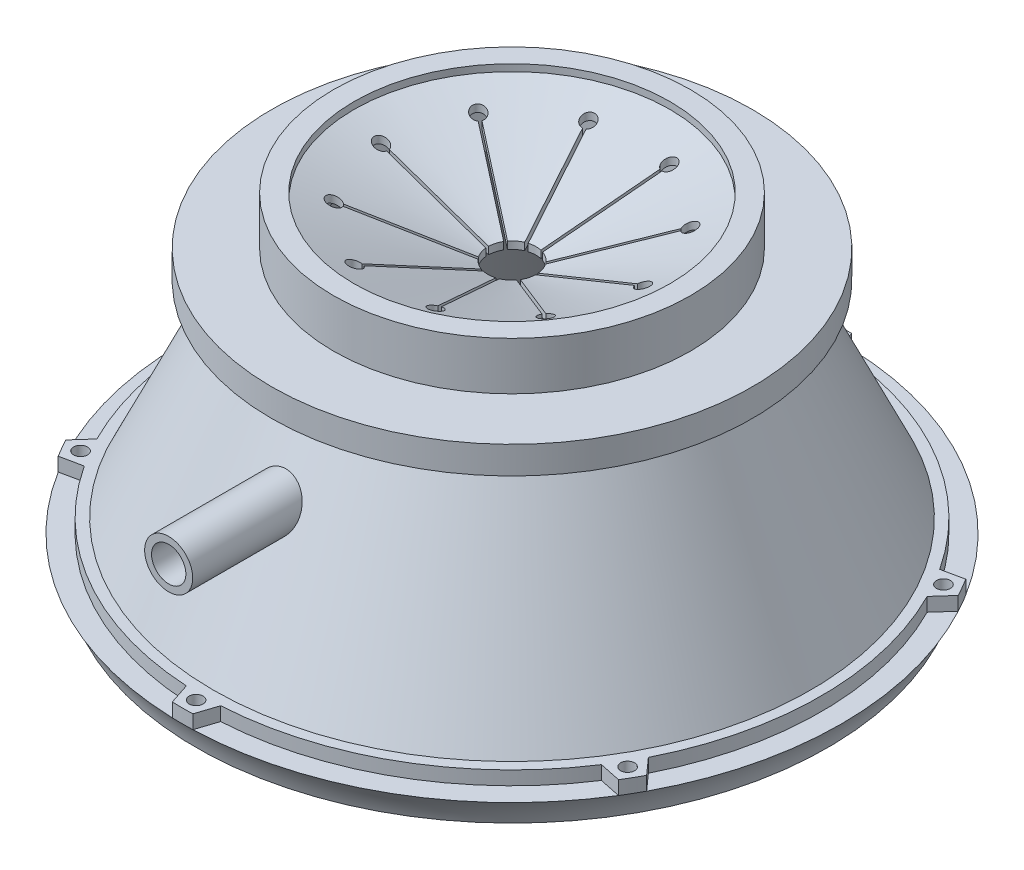
from build123d import *

# Parameters (mm, degrees)
SKETCH2_R           = 51.435
BOSS_EXTRUDE1_DEPTH = 2.54
SKETCH4_R           = 44.45
SKETCH4_R_2         = 29.21
BOSS_EXTRUDE2_DEPTH = 5.08
SKETCH7_R           = 33.02
SKETCH7_R_2         = 29.21
BOSS_EXTRUDE3_DEPTH = 8.89
CUT_EXTRUDE2_START  = -13.9700001
CUT_EXTRUDE2_DEPTH  = 10.974698256
SKETCH10_R          = 1.285113885
CUT_EXTRUDE3_DEPTH  = 2.54
CIRPATTERN1_COUNT   = 6
BOSS_EXTRUDE4_REACH = 152.895
SKETCH11_R          = 4.445
SKETCH12_R          = 3.175
CUT_EXTRUDE4_DEPTH  = 25.4


# Read off the part's stored shape, not the designer's step: Cut-Extrude2
with BuildPart() as part:
    # Sketch1 → Revolve1 (revolve)
    with BuildSketch(Plane.XY, mode=Mode.PRIVATE) as revolve1_sk:
        with BuildLine():
            Line((60.96, 5.08), (53.34, 5.08))
            Line((53.34, 5.08), (53.34, 0))
            Line((53.34, 0), (58.42, 0))
            ThreePointArc((58.42, 0), (59.483398793, 2.643300604), (60.96, 5.08))
        make_face()
    revolve(revolve1_sk.sketch.rotate(Axis((0, 0, 0), (0, 1, 0)), 90), axis=Axis((0, 0, 0), (0, 1, 0)))

    # Sketch2 → Boss-Extrude1 (add)
    with BuildSketch(Plane(origin=(0, 5.08, 0), x_dir=(1, 0, 0), z_dir=(0, 1, 0))):
        with BuildLine():
            Line((-1.905, 60.930227104), (-3.175, 57.061737399))
            ThreePointArc((-3.175, 57.061737399), (-28.575, 49.493351826), (-47.829414172, 31.280499357))
            Line((-47.829414172, 31.280499357), (-51.814624531, 32.114891946))
            ThreePointArc((-51.814624531, 32.114891946), (-52.792908615, 30.48), (-53.719624531, 28.815335158))
            Line((-53.719624531, 28.815335158), (-51.004414172, 25.781238043))
            ThreePointArc((-51.004414172, 25.781238043), (-57.15, 0), (-51.004414172, -25.781238043))
            Line((-51.004414172, -25.781238043), (-53.719624531, -28.815335158))
            ThreePointArc((-53.719624531, -28.815335158), (-52.792908615, -30.48), (-51.814624531, -32.114891946))
            Line((-51.814624531, -32.114891946), (-47.829414172, -31.280499357))
            ThreePointArc((-47.829414172, -31.280499357), (-28.575, -49.493351826), (-3.175, -57.061737399))
            Line((-3.175, -57.061737399), (-1.905, -60.930227104))
            ThreePointArc((-1.905, -60.930227104), (0, -60.96), (1.905, -60.930227104))
            Line((1.905, -60.930227104), (3.175, -57.061737399))
            ThreePointArc((3.175, -57.061737399), (28.575, -49.493351826), (47.829414172, -31.280499357))
            Line((47.829414172, -31.280499357), (51.814624531, -32.114891946))
            ThreePointArc((51.814624531, -32.114891946), (52.792908615, -30.48), (53.719624531, -28.815335158))
            Line((53.719624531, -28.815335158), (51.004414172, -25.781238043))
            ThreePointArc((51.004414172, -25.781238043), (57.15, 0), (51.004414172, 25.781238043))
            Line((51.004414172, 25.781238043), (53.719624531, 28.815335158))
            ThreePointArc((53.719624531, 28.815335158), (52.792908615, 30.48), (51.814624531, 32.114891946))
            Line((51.814624531, 32.114891946), (47.829414172, 31.280499357))
            ThreePointArc((47.829414172, 31.280499357), (28.575, 49.493351826), (3.175, 57.061737399))
            Line((3.175, 57.061737399), (1.905, 60.930227104))
            ThreePointArc((1.905, 60.930227104), (0, 60.96), (-1.905, 60.930227104))
        make_face()
        with Locations(Location((0, 0, 0), (0, 0, 270))):
            Circle(SKETCH2_R, mode=Mode.SUBTRACT)
    extrude(amount=BOSS_EXTRUDE1_DEPTH)

    # Sketch3 → Revolve2 (revolve)
    with BuildSketch(Plane.XY, mode=Mode.PRIVATE) as revolve2_sk:
        Polygon((-51.435, 7.62), (-33.668678224, 45.72), (-37.478678224, 45.72), (-55.245, 7.62), align=None)
    revolve(revolve2_sk.sketch.rotate(Axis((0, 45.72, 0), (0, 1, 0)), 90), axis=Axis((0, 45.72, 0), (0, 1, 0)))

    # Sketch4 → Boss-Extrude2 (add)
    with BuildSketch(Plane(origin=(0, 45.72, 0), x_dir=(1, 0, 0), z_dir=(0, 1, 0))):
        with Locations(Location((0, 0, 0), (0, 0, 270))):
            Circle(SKETCH4_R)
        with Locations(Location((0, 0, 0), (0, 0, 270))):
            Circle(SKETCH4_R_2, mode=Mode.SUBTRACT)
    extrude(amount=BOSS_EXTRUDE2_DEPTH)

    # Sketch7 → Boss-Extrude3 (add)
    with BuildSketch(Plane(origin=(0, 50.8, 0), x_dir=(1, 0, 0), z_dir=(0, 1, 0))):
        with Locations(Location((0, 0, 0), (0, 0, 270))):
            Circle(SKETCH7_R)
        with Locations(Location((0, 0, 0), (0, 0, 270))):
            Circle(SKETCH7_R_2, mode=Mode.SUBTRACT)
    extrude(amount=BOSS_EXTRUDE3_DEPTH)

    # Sketch8 → Revolve3 (revolve)
    with BuildSketch(Plane.XY, mode=Mode.PRIVATE) as revolve3_sk:
        Polygon((0, 47.082311557), (29.21, 58.42), (29.21, 57.057688443), (0, 45.72), align=None)
    revolve(revolve3_sk.sketch.rotate(Axis((0, 50.8, 0), (0, -1, 0)), 90), axis=Axis((0, 50.8, 0), (0, -1, 0)))

    # Cut-Extrude2 outline → Cut-Extrude2 (cut)
    with BuildSketch(Plane(origin=(0, 59.69, 0), x_dir=(1, 0, 0), z_dir=(0, 1, 0)).offset(CUT_EXTRUDE2_START)):
        with BuildLine():
            ThreePointArc((-0.994569109, -4.339743459), (0.141521891, -4.450001411), (1.2683112, -4.267777841))
            Line((1.2683112, -4.267777841), (7.306062216, -21.018511035))
            ThreePointArc((7.306062216, -21.018511035), (8.397605671, -23.297756201), (7.783964777, -20.84625248))
            Line((7.783964777, -20.84625248), (1.746213892, -4.095519264))
            ThreePointArc((1.746213892, -4.095519264), (2.730138817, -3.516942286), (3.53462219, -2.707210183))
            Line((3.53462219, -2.707210183), (18.26509934, -12.70993692))
            ThreePointArc((18.26509934, -12.70993692), (20.487883195, -13.912291948), (18.550479529, -12.289672857))
            Line((18.550479529, -12.289672857), (3.820002538, -2.286945912))
            ThreePointArc((3.820002538, -2.286945912), (4.275935508, -1.240530744), (4.450827641, -0.112580249))
            Line((4.450827641, -0.112580249), (22.247489269, 0.453400975))
            ThreePointArc((22.247489269, 0.453400975), (24.752485716, 0.787194932), (22.231341683, 0.961144263))
            Line((22.231341683, 0.961144263), (4.434680052, 0.395163048))
            ThreePointArc((4.434680052, 0.395163048), (4.18847017, 1.509721378), (3.666968211, 2.525051513))
            Line((3.666968211, 2.525051513), (17.732094251, 13.443555396))
            ThreePointArc((17.732094251, 13.443555396), (19.562480099, 15.186000045), (17.420586839, 13.844836755))
            Line((17.420586839, 13.844836755), (3.355460515, 2.926333154))
            ThreePointArc((3.355460515, 2.926333154), (2.501151587, 3.683311247), (1.48245156, 4.19819942))
            Line((1.48245156, 4.19819942), (6.443642218, 21.298728255))
            ThreePointArc((6.443642218, 21.298728255), (6.900271883, 23.784269443), (5.955759934, 21.440272253))
            Line((5.955759934, 21.440272253), (0.994569109, 4.339743459))
            ThreePointArc((0.994569109, 4.339743459), (-0.141521891, 4.450001411), (-1.2683112, 4.267777841))
            Line((-1.2683112, 4.267777841), (-7.306062277, 21.018510998))
            ThreePointArc((-7.306062277, 21.018510998), (-8.397605645, 23.29775621), (-7.783964763, 20.846252482))
            Line((-7.783964763, 20.846252482), (-1.746213892, 4.095519264))
            ThreePointArc((-1.746213892, 4.095519264), (-2.730138817, 3.516942286), (-3.53462219, 2.707210183))
            Line((-3.53462219, 2.707210183), (-18.265099344, 12.709936911))
            ThreePointArc((-18.265099344, 12.709936911), (-20.487883192, 13.91229195), (-18.550479529, 12.289672857))
            Line((-18.550479529, 12.289672857), (-3.820002538, 2.286945912))
            ThreePointArc((-3.820002538, 2.286945912), (-4.275935508, 1.240530744), (-4.450827641, 0.112580249))
            Line((-4.450827641, 0.112580249), (-22.247489269, -0.453400975))
            ThreePointArc((-22.247489269, -0.453400975), (-24.752485716, -0.787194932), (-22.231341683, -0.961144263))
            Line((-22.231341683, -0.961144263), (-4.434680052, -0.395163048))
            ThreePointArc((-4.434680052, -0.395163048), (-4.18847017, -1.509721378), (-3.666968211, -2.525051513))
            Line((-3.666968211, -2.525051513), (-17.732094308, -13.443555347))
            ThreePointArc((-17.732094308, -13.443555347), (-19.562480051, -15.186000107), (-17.420586877, -13.844836679))
            Line((-17.420586877, -13.844836679), (-3.355460515, -2.926333154))
            ThreePointArc((-3.355460515, -2.926333154), (-2.501151587, -3.683311247), (-1.48245156, -4.19819942))
            Line((-1.48245156, -4.19819942), (-6.443642178, -21.298728258))
            ThreePointArc((-6.443642178, -21.298728258), (-6.900271889, -23.784269441), (-5.955759961, -21.440272239))
            Line((-5.955759961, -21.440272239), (-0.994569109, -4.339743459))
        make_face()
    extrude(amount=CUT_EXTRUDE2_DEPTH, mode=Mode.SUBTRACT)

    # Sketch10 → Cut-Extrude3 (cut)
    with BuildSketch(Plane(origin=(0, 7.62, 0), x_dir=(1, 0, 0), z_dir=(0, 1, 0))):
        with Locations(Location((0, 58.42, 0), (0, 0, 270))):
            Circle(SKETCH10_R)
    cut_extrude3 = extrude(amount=-CUT_EXTRUDE3_DEPTH, mode=Mode.SUBTRACT)

    # CirPattern1: Cut-Extrude3 ×6 about axis
    cirpattern1_axis = Axis((0, 0, 0), (0, 1, 0))
    for i in range(1, CIRPATTERN1_COUNT):
        add(cut_extrude3.rotate(cirpattern1_axis, i * 360 / CIRPATTERN1_COUNT), mode=Mode.SUBTRACT)

    # Sketch11 → Boss-Extrude4 (add, up to next)
    with BuildSketch(Plane.XY.offset(63.5), mode=Mode.PRIVATE) as boss_extrude4_sk1:
        with Locations((0, 31.932164591)):
            Circle(SKETCH11_R)
    boss_extrude4_tool1 = extrude(boss_extrude4_sk1.sketch, amount=-BOSS_EXTRUDE4_REACH, mode=Mode.PRIVATE) - part.part
    add(boss_extrude4_tool1.solids().sort_by_distance((0, 31.932165, 63.5))[0])

    # Sketch12 → Cut-Extrude4 (cut)
    with BuildSketch(Plane.XY.offset(63.5)):
        with Locations((0, 31.932164591)):
            Circle(SKETCH12_R)
    extrude(amount=-CUT_EXTRUDE4_DEPTH, mode=Mode.SUBTRACT)


solid = part.part
